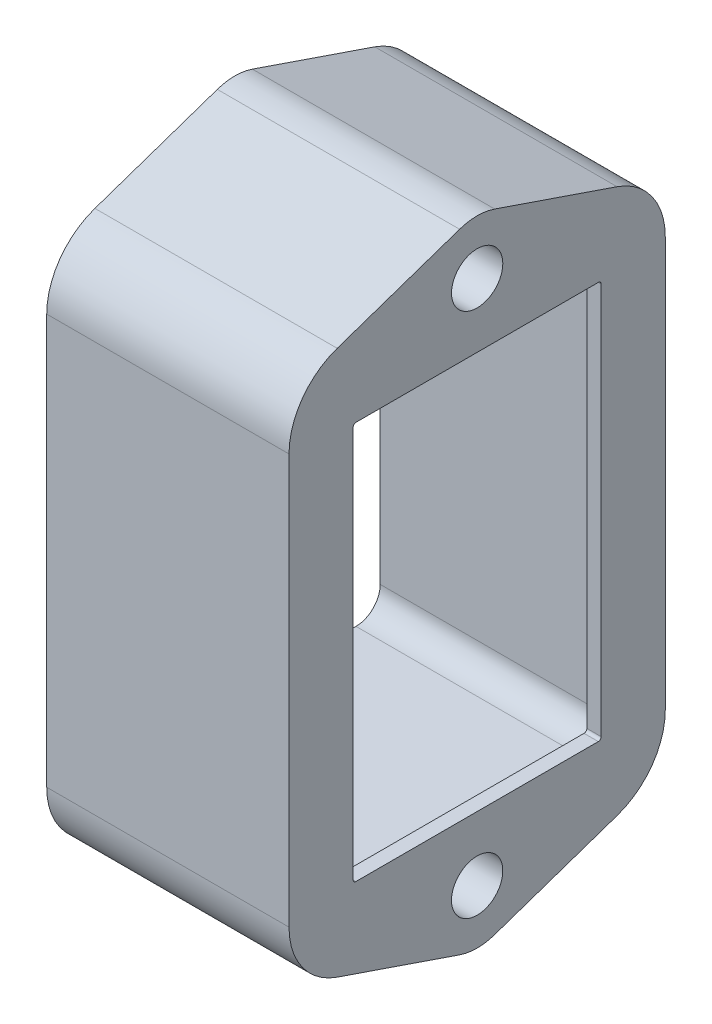
from build123d import *

# Parameters (mm, degrees)
SALIENTE_EXTRUIR1_DEPTH      = 2
SALIENTE_EXTRUIR1_DEPTH_BACK = 32
CROQUIS2_R                   = 3.6
SALIENTE_EXTRUIR2_START      = -2
SALIENTE_EXTRUIR2_DEPTH      = 2


with BuildPart() as part:
    # Croquis2 → Saliente-Extruir1 (new, two sides: drawn at the far end of the back side and taken through both)
    with BuildSketch(Plane(origin=(0, 0, 0), x_dir=(0, 0, -1), z_dir=(1, 0, 0)).offset(-SALIENTE_EXTRUIR1_DEPTH_BACK)):
        with BuildLine():
            Line((-26.4, -41.464925013), (-26.4, 16.039678623))
            ThreePointArc((-26.4, 16.039678623), (-24.535471531, 21.85466813), (-19.637179406, 25.501214941))
            Line((-19.637179406, 25.501214941), (-2.460256349, 31.378144407))
            ThreePointArc((-2.460256349, 31.378144407), (0, 31.787376805), (2.460256349, 31.378144407))
            Line((2.460256349, 31.378144407), (19.637179406, 25.501214941))
            ThreePointArc((19.637179406, 25.501214941), (24.535471531, 21.85466813), (26.4, 16.039678623))
            Line((26.4, 16.039678623), (26.4, -41.464925013))
            ThreePointArc((26.4, -41.464925013), (24.535471531, -47.27991452), (19.637179406, -50.92646133))
            Line((19.637179406, -50.92646133), (2.460256349, -56.803390796))
            ThreePointArc((2.460256349, -56.803390796), (0, -57.212623195), (-2.460256349, -56.803390796))
            Line((-2.460256349, -56.803390796), (-19.637179406, -50.92646133))
            ThreePointArc((-19.637179406, -50.92646133), (-24.535471531, -47.27991452), (-26.4, -41.464925013))
        make_face()
        with Locations((0, 24.187376805)):
            Circle(CROQUIS2_R, mode=Mode.SUBTRACT)
        with Locations((0, -49.612623195)):
            Circle(CROQUIS2_R, mode=Mode.SUBTRACT)
        with BuildLine():
            Line((20.4, -40.212623195), (20.4, 14.787376805))
            ThreePointArc((20.4, 14.787376805), (19.404163056, 17.191539861), (17, 18.187376805))
            Line((17, 18.187376805), (0, 18.187376805))
            Line((0, 18.187376805), (-17, 18.187376805))
            ThreePointArc((-17, 18.187376805), (-19.404163056, 17.191539861), (-20.4, 14.787376805))
            Line((-20.4, 14.787376805), (-20.4, -40.212623195))
            ThreePointArc((-20.4, -40.212623195), (-19.404163056, -42.616786251), (-17, -43.612623195))
            Line((-17, -43.612623195), (0, -43.612623195))
            Line((0, -43.612623195), (17, -43.612623195))
            ThreePointArc((17, -43.612623195), (19.404163056, -42.616786251), (20.4, -40.212623195))
        make_face(mode=Mode.SUBTRACT)
    extrude(amount=SALIENTE_EXTRUIR1_DEPTH + SALIENTE_EXTRUIR1_DEPTH_BACK)

    # Croquis3 → Saliente-Extruir2 (add)
    with BuildSketch(Plane(origin=(2, 0, 0), x_dir=(0, 0, -1), z_dir=(1, 0, 0)).offset(SALIENTE_EXTRUIR2_START)):
        with BuildLine():
            Line((-17, -43.612623195), (17, -43.612623195))
            ThreePointArc((17, -43.612623195), (19.404163056, -42.616786251), (20.4, -40.212623195))
            Line((20.4, -40.212623195), (20.4, 14.787376805))
            ThreePointArc((20.4, 14.787376805), (19.404163056, 17.191539861), (17, 18.187376805))
            Line((17, 18.187376805), (-17, 18.187376805))
            ThreePointArc((-17, 18.187376805), (-19.404163056, 17.191539861), (-20.4, 14.787376805))
            Line((-20.4, 14.787376805), (-20.4, -40.212623195))
            ThreePointArc((-20.4, -40.212623195), (-19.404163056, -42.616786251), (-17, -43.612623195))
        make_face()
        with BuildLine():
            Line((-17, -40.612623195), (17, -40.612623195))
            ThreePointArc((17, -40.612623195), (17.282842712, -40.495465907), (17.4, -40.212623195))
            Line((17.4, -40.212623195), (17.4, 14.787376805))
            ThreePointArc((17.4, 14.787376805), (17.282842712, 15.070219518), (17, 15.187376805))
            Line((17, 15.187376805), (-17, 15.187376805))
            ThreePointArc((-17, 15.187376805), (-17.282842712, 15.070219518), (-17.4, 14.787376805))
            Line((-17.4, 14.787376805), (-17.4, -40.212623195))
            ThreePointArc((-17.4, -40.212623195), (-17.282842712, -40.495465907), (-17, -40.612623195))
        make_face(mode=Mode.SUBTRACT)
    extrude(amount=SALIENTE_EXTRUIR2_DEPTH)


solid = part.part
